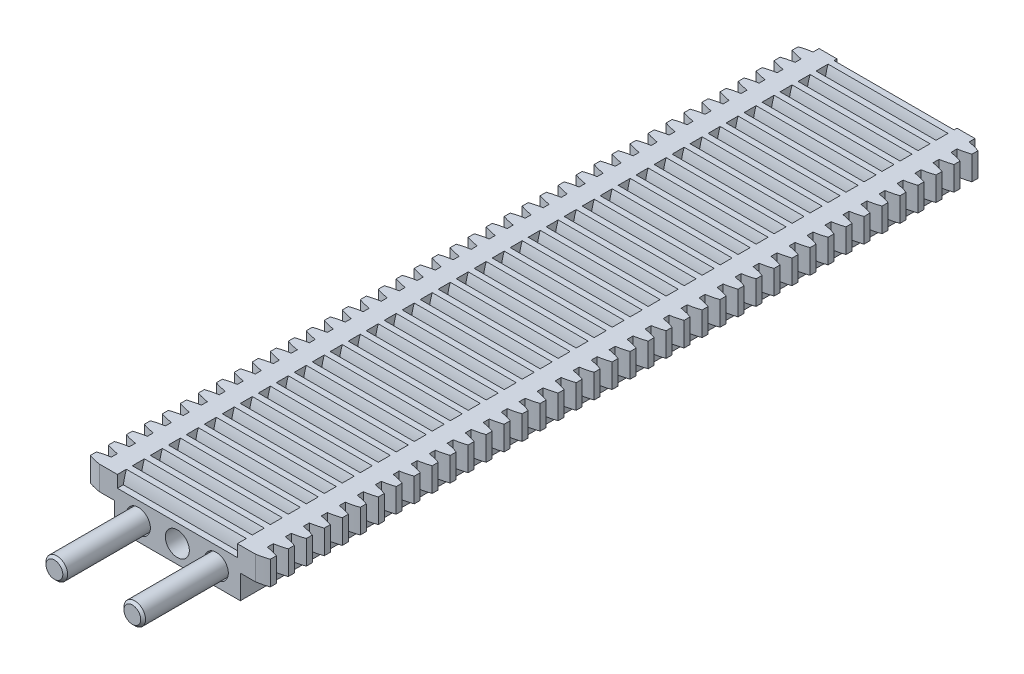
from build123d import *

# Parameters (mm, degrees)
EXTRUDE_1_DEPTH        = 60
EXTRUDE_START          = -3
EXTRUDE_2_DEPTH        = 54
SKETCH_3_R             = 1
CUT_EXTRUDE_1_DEPTH    = 61.483468816
EXTRUDE_3_DEPTH        = 7
EXTRUDE_3_DEPTH_BACK   = 7
SKETCH_4_R             = 0.9
EXTRUDE_3_2_DEPTH      = 7
EXTRUDE_3_2_DEPTH_BACK = 7
FILLET_1_R             = 0.1
CHAMFER_2_SIZE         = 0.2
CHAMFER_3_SIZE         = 0.2
EXTRUDE_4_DEPTH        = 2
CUT_EXTRUDE_2_DEPTH    = 5
CUT_EXTRUDE_START      = 5
CUT_EXTRUDE_3_DEPTH    = 5


with BuildPart() as part:
    # 草图1 → 凸台-拉伸1 (new body)
    with BuildSketch(Plane.XY):
        Polygon((5.25, 2), (6.5, 2), (6.5, 4), (-6.5, 4), (-6.5, 2), (-5.25, 2), (-5.25, 0), (5.25, 0), align=None)
    extrude(amount=-EXTRUDE_1_DEPTH)

    # 草图2 → 凸台-拉伸2 (add)
    with BuildSketch(Plane.XY.offset(EXTRUDE_START)):
        with BuildLine():
            Line((-1.95, -1.555590279), (-1.95, -2.5))
            Line((-1.95, -2.5), (-1.165769145, -2.5))
            Line((-1.165769145, -2.5), (0, 0))
            Line((0, 0), (-1.5, 0))
            Line((-1.5, 0), (-1.5, -0.677124344))
            ThreePointArc((-1.5, -0.677124344), (-1.780042303, -1.088161527), (-1.95, -1.555590279))
        make_face()
        with BuildLine():
            Line((1.5, 0), (0, 0))
            Line((0, 0), (1.165769145, -2.5))
            Line((1.165769145, -2.5), (1.95, -2.5))
            Line((1.95, -2.5), (1.95, -1.555590279))
            ThreePointArc((1.95, -1.555590279), (1.780042303, -1.088161527), (1.5, -0.677124344))
            Line((1.5, -0.677124344), (1.5, 0))
        make_face()
    extrude(amount=-EXTRUDE_2_DEPTH)

    # 草图3 → 切除-拉伸1 (cut, through all)
    with BuildSketch(Plane.XY):
        with Locations((-3.25, 1.5)):
            Circle(SKETCH_3_R)
        with Locations((0, 1.5)):
            Circle(SKETCH_3_R)
        with Locations((3.25, 1.5)):
            Circle(SKETCH_3_R)
    extrude(amount=-CUT_EXTRUDE_1_DEPTH, mode=Mode.SUBTRACT)

    # 圆角1
    fillet_1_edges = [part.edges().sort_by_distance(p)[0] for p in [
        (-1.557884573, -2.5, -57),
        (-1.165769145, -2.5, -30),
        (-1.95, -2.5, -30),
        (-1.557884573, -2.5, -3),
        (1.557884573, -2.5, -57),
        (1.95, -2.5, -30),
        (1.165769145, -2.5, -30),
        (1.557884573, -2.5, -3),
    ]]
    fillet(fillet_1_edges, radius=FILLET_1_R)

    # 草图6 → 凸台-拉伸4 (add)
    with BuildSketch(Plane(origin=(0, 4, 0), x_dir=(1, 0, 0), z_dir=(0, 1, 0))):
        with BuildLine():
            Line((-6.5, 59.5), (-6.5, 58.5))
            ThreePointArc((-6.5, 58.5), (-7.005883165, 58.601467338), (-7.5, 58.75))
            Line((-7.5, 58.75), (-7.5, 59.25))
            ThreePointArc((-7.5, 59.25), (-7.005883165, 59.398532662), (-6.5, 59.5))
        make_face()
        with BuildLine():
            Line((-6.5, 58), (-6.5, 57))
            ThreePointArc((-6.5, 57), (-7.005883165, 57.101467338), (-7.5, 57.25))
            Line((-7.5, 57.25), (-7.5, 57.75))
            ThreePointArc((-7.5, 57.75), (-7.005883165, 57.898532662), (-6.5, 58))
        make_face()
        with BuildLine():
            Line((-7.5, 56.25), (-7.5, 55.75))
            ThreePointArc((-7.5, 55.75), (-7.005883165, 55.601467338), (-6.5, 55.5))
            Line((-6.5, 55.5), (-6.5, 56.5))
            ThreePointArc((-6.5, 56.5), (-7.005883165, 56.398532662), (-7.5, 56.25))
        make_face()
        with BuildLine():
            Line((-7.5, 54.75), (-7.5, 54.25))
            ThreePointArc((-7.5, 54.25), (-7.005883165, 54.101467338), (-6.5, 54))
            Line((-6.5, 54), (-6.5, 55))
            ThreePointArc((-6.5, 55), (-7.005883165, 54.898532662), (-7.5, 54.75))
        make_face()
        with BuildLine():
            Line((-7.5, 53.25), (-7.5, 52.75))
            ThreePointArc((-7.5, 52.75), (-7.005883165, 52.601467338), (-6.5, 52.5))
            Line((-6.5, 52.5), (-6.5, 53.5))
            ThreePointArc((-6.5, 53.5), (-7.005883165, 53.398532662), (-7.5, 53.25))
        make_face()
        with BuildLine():
            Line((-7.5, 51.75), (-7.5, 51.25))
            ThreePointArc((-7.5, 51.25), (-7.005883165, 51.101467338), (-6.5, 51))
            Line((-6.5, 51), (-6.5, 52))
            ThreePointArc((-6.5, 52), (-7.005883165, 51.898532662), (-7.5, 51.75))
        make_face()
        with BuildLine():
            Line((-7.5, 50.25), (-7.5, 49.75))
            ThreePointArc((-7.5, 49.75), (-7.005883165, 49.601467338), (-6.5, 49.5))
            Line((-6.5, 49.5), (-6.5, 50.5))
            ThreePointArc((-6.5, 50.5), (-7.005883165, 50.398532662), (-7.5, 50.25))
        make_face()
        with BuildLine():
            Line((-7.5, 48.75), (-7.5, 48.25))
            ThreePointArc((-7.5, 48.25), (-7.005883165, 48.101467338), (-6.5, 48))
            Line((-6.5, 48), (-6.5, 49))
            ThreePointArc((-6.5, 49), (-7.005883165, 48.898532662), (-7.5, 48.75))
        make_face()
        with BuildLine():
            Line((-7.5, 47.25), (-7.5, 46.75))
            ThreePointArc((-7.5, 46.75), (-7.005883165, 46.601467338), (-6.5, 46.5))
            Line((-6.5, 46.5), (-6.5, 47.5))
            ThreePointArc((-6.5, 47.5), (-7.005883165, 47.398532662), (-7.5, 47.25))
        make_face()
        with BuildLine():
            Line((-7.5, 45.75), (-7.5, 45.25))
            ThreePointArc((-7.5, 45.25), (-7.005883165, 45.101467338), (-6.5, 45))
            Line((-6.5, 45), (-6.5, 46))
            ThreePointArc((-6.5, 46), (-7.005883165, 45.898532662), (-7.5, 45.75))
        make_face()
        with BuildLine():
            Line((-7.5, 44.25), (-7.5, 43.75))
            ThreePointArc((-7.5, 43.75), (-7.005883165, 43.601467338), (-6.5, 43.5))
            Line((-6.5, 43.5), (-6.5, 44.5))
            ThreePointArc((-6.5, 44.5), (-7.005883165, 44.398532662), (-7.5, 44.25))
        make_face()
        with BuildLine():
            Line((-7.5, 42.75), (-7.5, 42.25))
            ThreePointArc((-7.5, 42.25), (-7.005883165, 42.101467338), (-6.5, 42))
            Line((-6.5, 42), (-6.5, 43))
            ThreePointArc((-6.5, 43), (-7.005883165, 42.898532662), (-7.5, 42.75))
        make_face()
        with BuildLine():
            Line((-7.5, 41.25), (-7.5, 40.75))
            ThreePointArc((-7.5, 40.75), (-7.005883165, 40.601467338), (-6.5, 40.5))
            Line((-6.5, 40.5), (-6.5, 41.5))
            ThreePointArc((-6.5, 41.5), (-7.005883165, 41.398532662), (-7.5, 41.25))
        make_face()
        with BuildLine():
            Line((-7.5, 39.75), (-7.5, 39.25))
            ThreePointArc((-7.5, 39.25), (-7.005883165, 39.101467338), (-6.5, 39))
            Line((-6.5, 39), (-6.5, 40))
            ThreePointArc((-6.5, 40), (-7.005883165, 39.898532662), (-7.5, 39.75))
        make_face()
        with BuildLine():
            Line((-7.5, 38.25), (-7.5, 37.75))
            ThreePointArc((-7.5, 37.75), (-7.005883165, 37.601467338), (-6.5, 37.5))
            Line((-6.5, 37.5), (-6.5, 38.5))
            ThreePointArc((-6.5, 38.5), (-7.005883165, 38.398532662), (-7.5, 38.25))
        make_face()
        with BuildLine():
            Line((-7.5, 36.75), (-7.5, 36.25))
            ThreePointArc((-7.5, 36.25), (-7.005883165, 36.101467338), (-6.5, 36))
            Line((-6.5, 36), (-6.5, 37))
            ThreePointArc((-6.5, 37), (-7.005883165, 36.898532662), (-7.5, 36.75))
        make_face()
        with BuildLine():
            Line((-7.5, 35.25), (-7.5, 34.75))
            ThreePointArc((-7.5, 34.75), (-7.005883165, 34.601467338), (-6.5, 34.5))
            Line((-6.5, 34.5), (-6.5, 35.5))
            ThreePointArc((-6.5, 35.5), (-7.005883165, 35.398532662), (-7.5, 35.25))
        make_face()
        with BuildLine():
            Line((-7.5, 33.75), (-7.5, 33.25))
            ThreePointArc((-7.5, 33.25), (-7.005883165, 33.101467338), (-6.5, 33))
            Line((-6.5, 33), (-6.5, 34))
            ThreePointArc((-6.5, 34), (-7.005883165, 33.898532662), (-7.5, 33.75))
        make_face()
        with BuildLine():
            Line((-7.5, 32.25), (-7.5, 31.75))
            ThreePointArc((-7.5, 31.75), (-7.005883165, 31.601467338), (-6.5, 31.5))
            Line((-6.5, 31.5), (-6.5, 32.5))
            ThreePointArc((-6.5, 32.5), (-7.005883165, 32.398532662), (-7.5, 32.25))
        make_face()
        with BuildLine():
            Line((-7.5, 30.75), (-7.5, 30.25))
            ThreePointArc((-7.5, 30.25), (-7.005883165, 30.101467338), (-6.5, 30))
            Line((-6.5, 30), (-6.5, 31))
            ThreePointArc((-6.5, 31), (-7.005883165, 30.898532662), (-7.5, 30.75))
        make_face()
        with BuildLine():
            Line((-7.5, 29.25), (-7.5, 28.75))
            ThreePointArc((-7.5, 28.75), (-7.005883165, 28.601467338), (-6.5, 28.5))
            Line((-6.5, 28.5), (-6.5, 29.5))
            ThreePointArc((-6.5, 29.5), (-7.005883165, 29.398532662), (-7.5, 29.25))
        make_face()
        with BuildLine():
            Line((-7.5, 27.75), (-7.5, 27.25))
            ThreePointArc((-7.5, 27.25), (-7.005883165, 27.101467338), (-6.5, 27))
            Line((-6.5, 27), (-6.5, 28))
            ThreePointArc((-6.5, 28), (-7.005883165, 27.898532662), (-7.5, 27.75))
        make_face()
        with BuildLine():
            Line((-7.5, 26.25), (-7.5, 25.75))
            ThreePointArc((-7.5, 25.75), (-7.005883165, 25.601467338), (-6.5, 25.5))
            Line((-6.5, 25.5), (-6.5, 26.5))
            ThreePointArc((-6.5, 26.5), (-7.005883165, 26.398532662), (-7.5, 26.25))
        make_face()
        with BuildLine():
            Line((-7.5, 24.75), (-7.5, 24.25))
            ThreePointArc((-7.5, 24.25), (-7.005883165, 24.101467338), (-6.5, 24))
            Line((-6.5, 24), (-6.5, 25))
            ThreePointArc((-6.5, 25), (-7.005883165, 24.898532662), (-7.5, 24.75))
        make_face()
        with BuildLine():
            Line((-7.5, 23.25), (-7.5, 22.75))
            ThreePointArc((-7.5, 22.75), (-7.005883165, 22.601467338), (-6.5, 22.5))
            Line((-6.5, 22.5), (-6.5, 23.5))
            ThreePointArc((-6.5, 23.5), (-7.005883165, 23.398532662), (-7.5, 23.25))
        make_face()
        with BuildLine():
            Line((-7.5, 21.75), (-7.5, 21.25))
            ThreePointArc((-7.5, 21.25), (-7.005883165, 21.101467338), (-6.5, 21))
            Line((-6.5, 21), (-6.5, 22))
            ThreePointArc((-6.5, 22), (-7.005883165, 21.898532662), (-7.5, 21.75))
        make_face()
        with BuildLine():
            Line((-7.5, 20.25), (-7.5, 19.75))
            ThreePointArc((-7.5, 19.75), (-7.005883165, 19.601467338), (-6.5, 19.5))
            Line((-6.5, 19.5), (-6.5, 20.5))
            ThreePointArc((-6.5, 20.5), (-7.005883165, 20.398532662), (-7.5, 20.25))
        make_face()
        with BuildLine():
            Line((-7.5, 18.75), (-7.5, 18.25))
            ThreePointArc((-7.5, 18.25), (-7.005883165, 18.101467338), (-6.5, 18))
            Line((-6.5, 18), (-6.5, 19))
            ThreePointArc((-6.5, 19), (-7.005883165, 18.898532662), (-7.5, 18.75))
        make_face()
        with BuildLine():
            Line((-7.5, 17.25), (-7.5, 16.75))
            ThreePointArc((-7.5, 16.75), (-7.005883165, 16.601467338), (-6.5, 16.5))
            Line((-6.5, 16.5), (-6.5, 17.5))
            ThreePointArc((-6.5, 17.5), (-7.005883165, 17.398532662), (-7.5, 17.25))
        make_face()
        with BuildLine():
            Line((-7.5, 15.75), (-7.5, 15.25))
            ThreePointArc((-7.5, 15.25), (-7.005883165, 15.101467338), (-6.5, 15))
            Line((-6.5, 15), (-6.5, 16))
            ThreePointArc((-6.5, 16), (-7.005883165, 15.898532662), (-7.5, 15.75))
        make_face()
        with BuildLine():
            Line((-7.5, 14.25), (-7.5, 13.75))
            ThreePointArc((-7.5, 13.75), (-7.005883165, 13.601467338), (-6.5, 13.5))
            Line((-6.5, 13.5), (-6.5, 14.5))
            ThreePointArc((-6.5, 14.5), (-7.005883165, 14.398532662), (-7.5, 14.25))
        make_face()
        with BuildLine():
            Line((-7.5, 12.75), (-7.5, 12.25))
            ThreePointArc((-7.5, 12.25), (-7.005883165, 12.101467338), (-6.5, 12))
            Line((-6.5, 12), (-6.5, 13))
            ThreePointArc((-6.5, 13), (-7.005883165, 12.898532662), (-7.5, 12.75))
        make_face()
        with BuildLine():
            Line((-7.5, 11.25), (-7.5, 10.75))
            ThreePointArc((-7.5, 10.75), (-7.005883165, 10.601467338), (-6.5, 10.5))
            Line((-6.5, 10.5), (-6.5, 11.5))
            ThreePointArc((-6.5, 11.5), (-7.005883165, 11.398532662), (-7.5, 11.25))
        make_face()
        with BuildLine():
            Line((-7.5, 9.75), (-7.5, 9.25))
            ThreePointArc((-7.5, 9.25), (-7.005883165, 9.101467338), (-6.5, 9))
            Line((-6.5, 9), (-6.5, 10))
            ThreePointArc((-6.5, 10), (-7.005883165, 9.898532662), (-7.5, 9.75))
        make_face()
        with BuildLine():
            Line((-7.5, 8.25), (-7.5, 7.75))
            ThreePointArc((-7.5, 7.75), (-7.005883165, 7.601467338), (-6.5, 7.5))
            Line((-6.5, 7.5), (-6.5, 8.5))
            ThreePointArc((-6.5, 8.5), (-7.005883165, 8.398532662), (-7.5, 8.25))
        make_face()
        with BuildLine():
            Line((-7.5, 6.75), (-7.5, 6.25))
            ThreePointArc((-7.5, 6.25), (-7.005883165, 6.101467338), (-6.5, 6))
            Line((-6.5, 6), (-6.5, 7))
            ThreePointArc((-6.5, 7), (-7.005883165, 6.898532662), (-7.5, 6.75))
        make_face()
        with BuildLine():
            Line((-7.5, 5.25), (-7.5, 4.75))
            ThreePointArc((-7.5, 4.75), (-7.005883165, 4.601467338), (-6.5, 4.5))
            Line((-6.5, 4.5), (-6.5, 5.5))
            ThreePointArc((-6.5, 5.5), (-7.005883165, 5.398532662), (-7.5, 5.25))
        make_face()
        with BuildLine():
            Line((-7.5, 3.75), (-7.5, 3.25))
            ThreePointArc((-7.5, 3.25), (-7.005883165, 3.101467338), (-6.5, 3))
            Line((-6.5, 3), (-6.5, 4))
            ThreePointArc((-6.5, 4), (-7.005883165, 3.898532662), (-7.5, 3.75))
        make_face()
        with BuildLine():
            Line((-7.5, 2.25), (-7.5, 1.75))
            ThreePointArc((-7.5, 1.75), (-7.005883165, 1.601467338), (-6.5, 1.5))
            Line((-6.5, 1.5), (-6.5, 2.5))
            ThreePointArc((-6.5, 2.5), (-7.005883165, 2.398532662), (-7.5, 2.25))
        make_face()
        with BuildLine():
            Line((-6.5, 1), (-6.5, 0))
            ThreePointArc((-6.5, 0), (-7.005883165, 0.101467338), (-7.5, 0.25))
            Line((-7.5, 0.25), (-7.5, 0.75))
            ThreePointArc((-7.5, 0.75), (-7.005883165, 0.898532662), (-6.5, 1))
        make_face()
        with BuildLine():
            Line((7.5, 0.75), (7.5, 0.25))
            ThreePointArc((7.5, 0.25), (7.005883165, 0.101467338), (6.5, 0))
            Line((6.5, 0), (6.5, 1))
            ThreePointArc((6.5, 1), (7.005883165, 0.898532662), (7.5, 0.75))
        make_face()
        with BuildLine():
            Line((6.5, 2.5), (6.5, 1.5))
            ThreePointArc((6.5, 1.5), (7.005883165, 1.601467338), (7.5, 1.75))
            Line((7.5, 1.75), (7.5, 2.25))
            ThreePointArc((7.5, 2.25), (7.005883165, 2.398532662), (6.5, 2.5))
        make_face()
        with BuildLine():
            Line((6.5, 4), (6.5, 3))
            ThreePointArc((6.5, 3), (7.005883165, 3.101467338), (7.5, 3.25))
            Line((7.5, 3.25), (7.5, 3.75))
            ThreePointArc((7.5, 3.75), (7.005883165, 3.898532662), (6.5, 4))
        make_face()
        with BuildLine():
            Line((6.5, 5.5), (6.5, 4.5))
            ThreePointArc((6.5, 4.5), (7.005883165, 4.601467338), (7.5, 4.75))
            Line((7.5, 4.75), (7.5, 5.25))
            ThreePointArc((7.5, 5.25), (7.005883165, 5.398532662), (6.5, 5.5))
        make_face()
        with BuildLine():
            Line((6.5, 7), (6.5, 6))
            ThreePointArc((6.5, 6), (7.005883165, 6.101467338), (7.5, 6.25))
            Line((7.5, 6.25), (7.5, 6.75))
            ThreePointArc((7.5, 6.75), (7.005883165, 6.898532662), (6.5, 7))
        make_face()
        with BuildLine():
            Line((6.5, 8.5), (6.5, 7.5))
            ThreePointArc((6.5, 7.5), (7.005883165, 7.601467338), (7.5, 7.75))
            Line((7.5, 7.75), (7.5, 8.25))
            ThreePointArc((7.5, 8.25), (7.005883165, 8.398532662), (6.5, 8.5))
        make_face()
        with BuildLine():
            Line((6.5, 10), (6.5, 9))
            ThreePointArc((6.5, 9), (7.005883165, 9.101467338), (7.5, 9.25))
            Line((7.5, 9.25), (7.5, 9.75))
            ThreePointArc((7.5, 9.75), (7.005883165, 9.898532662), (6.5, 10))
        make_face()
        with BuildLine():
            Line((6.5, 11.5), (6.5, 10.5))
            ThreePointArc((6.5, 10.5), (7.005883165, 10.601467338), (7.5, 10.75))
            Line((7.5, 10.75), (7.5, 11.25))
            ThreePointArc((7.5, 11.25), (7.005883165, 11.398532662), (6.5, 11.5))
        make_face()
        with BuildLine():
            Line((6.5, 13), (6.5, 12))
            ThreePointArc((6.5, 12), (7.005883165, 12.101467338), (7.5, 12.25))
            Line((7.5, 12.25), (7.5, 12.75))
            ThreePointArc((7.5, 12.75), (7.005883165, 12.898532662), (6.5, 13))
        make_face()
        with BuildLine():
            Line((6.5, 14.5), (6.5, 13.5))
            ThreePointArc((6.5, 13.5), (7.005883165, 13.601467338), (7.5, 13.75))
            Line((7.5, 13.75), (7.5, 14.25))
            ThreePointArc((7.5, 14.25), (7.005883165, 14.398532662), (6.5, 14.5))
        make_face()
        with BuildLine():
            Line((6.5, 16), (6.5, 15))
            ThreePointArc((6.5, 15), (7.005883165, 15.101467338), (7.5, 15.25))
            Line((7.5, 15.25), (7.5, 15.75))
            ThreePointArc((7.5, 15.75), (7.005883165, 15.898532662), (6.5, 16))
        make_face()
        with BuildLine():
            Line((6.5, 17.5), (6.5, 16.5))
            ThreePointArc((6.5, 16.5), (7.005883165, 16.601467338), (7.5, 16.75))
            Line((7.5, 16.75), (7.5, 17.25))
            ThreePointArc((7.5, 17.25), (7.005883165, 17.398532662), (6.5, 17.5))
        make_face()
        with BuildLine():
            Line((6.5, 19), (6.5, 18))
            ThreePointArc((6.5, 18), (7.005883165, 18.101467338), (7.5, 18.25))
            Line((7.5, 18.25), (7.5, 18.75))
            ThreePointArc((7.5, 18.75), (7.005883165, 18.898532662), (6.5, 19))
        make_face()
        with BuildLine():
            Line((6.5, 20.5), (6.5, 19.5))
            ThreePointArc((6.5, 19.5), (7.005883165, 19.601467338), (7.5, 19.75))
            Line((7.5, 19.75), (7.5, 20.25))
            ThreePointArc((7.5, 20.25), (7.005883165, 20.398532662), (6.5, 20.5))
        make_face()
        with BuildLine():
            Line((6.5, 22), (6.5, 21))
            ThreePointArc((6.5, 21), (7.005883165, 21.101467338), (7.5, 21.25))
            Line((7.5, 21.25), (7.5, 21.75))
            ThreePointArc((7.5, 21.75), (7.005883165, 21.898532662), (6.5, 22))
        make_face()
        with BuildLine():
            Line((6.5, 23.5), (6.5, 22.5))
            ThreePointArc((6.5, 22.5), (7.005883165, 22.601467338), (7.5, 22.75))
            Line((7.5, 22.75), (7.5, 23.25))
            ThreePointArc((7.5, 23.25), (7.005883165, 23.398532662), (6.5, 23.5))
        make_face()
        with BuildLine():
            Line((6.5, 25), (6.5, 24))
            ThreePointArc((6.5, 24), (7.005883165, 24.101467338), (7.5, 24.25))
            Line((7.5, 24.25), (7.5, 24.75))
            ThreePointArc((7.5, 24.75), (7.005883165, 24.898532662), (6.5, 25))
        make_face()
        with BuildLine():
            Line((6.5, 26.5), (6.5, 25.5))
            ThreePointArc((6.5, 25.5), (7.005883165, 25.601467338), (7.5, 25.75))
            Line((7.5, 25.75), (7.5, 26.25))
            ThreePointArc((7.5, 26.25), (7.005883165, 26.398532662), (6.5, 26.5))
        make_face()
        with BuildLine():
            Line((6.5, 28), (6.5, 27))
            ThreePointArc((6.5, 27), (7.005883165, 27.101467338), (7.5, 27.25))
            Line((7.5, 27.25), (7.5, 27.75))
            ThreePointArc((7.5, 27.75), (7.005883165, 27.898532662), (6.5, 28))
        make_face()
        with BuildLine():
            Line((6.5, 29.5), (6.5, 28.5))
            ThreePointArc((6.5, 28.5), (7.005883165, 28.601467338), (7.5, 28.75))
            Line((7.5, 28.75), (7.5, 29.25))
            ThreePointArc((7.5, 29.25), (7.005883165, 29.398532662), (6.5, 29.5))
        make_face()
        with BuildLine():
            Line((6.5, 31), (6.5, 30))
            ThreePointArc((6.5, 30), (7.005883165, 30.101467338), (7.5, 30.25))
            Line((7.5, 30.25), (7.5, 30.75))
            ThreePointArc((7.5, 30.75), (7.005883165, 30.898532662), (6.5, 31))
        make_face()
        with BuildLine():
            Line((6.5, 32.5), (6.5, 31.5))
            ThreePointArc((6.5, 31.5), (7.005883165, 31.601467338), (7.5, 31.75))
            Line((7.5, 31.75), (7.5, 32.25))
            ThreePointArc((7.5, 32.25), (7.005883165, 32.398532662), (6.5, 32.5))
        make_face()
        with BuildLine():
            Line((6.5, 34), (6.5, 33))
            ThreePointArc((6.5, 33), (7.005883165, 33.101467338), (7.5, 33.25))
            Line((7.5, 33.25), (7.5, 33.75))
            ThreePointArc((7.5, 33.75), (7.005883165, 33.898532662), (6.5, 34))
        make_face()
        with BuildLine():
            Line((6.5, 35.5), (6.5, 34.5))
            ThreePointArc((6.5, 34.5), (7.005883165, 34.601467338), (7.5, 34.75))
            Line((7.5, 34.75), (7.5, 35.25))
            ThreePointArc((7.5, 35.25), (7.005883165, 35.398532662), (6.5, 35.5))
        make_face()
        with BuildLine():
            Line((6.5, 37), (6.5, 36))
            ThreePointArc((6.5, 36), (7.005883165, 36.101467338), (7.5, 36.25))
            Line((7.5, 36.25), (7.5, 36.75))
            ThreePointArc((7.5, 36.75), (7.005883165, 36.898532662), (6.5, 37))
        make_face()
        with BuildLine():
            Line((6.5, 38.5), (6.5, 37.5))
            ThreePointArc((6.5, 37.5), (7.005883165, 37.601467338), (7.5, 37.75))
            Line((7.5, 37.75), (7.5, 38.25))
            ThreePointArc((7.5, 38.25), (7.005883165, 38.398532662), (6.5, 38.5))
        make_face()
        with BuildLine():
            Line((6.5, 40), (6.5, 39))
            ThreePointArc((6.5, 39), (7.005883165, 39.101467338), (7.5, 39.25))
            Line((7.5, 39.25), (7.5, 39.75))
            ThreePointArc((7.5, 39.75), (7.005883165, 39.898532662), (6.5, 40))
        make_face()
        with BuildLine():
            Line((6.5, 41.5), (6.5, 40.5))
            ThreePointArc((6.5, 40.5), (7.005883165, 40.601467338), (7.5, 40.75))
            Line((7.5, 40.75), (7.5, 41.25))
            ThreePointArc((7.5, 41.25), (7.005883165, 41.398532662), (6.5, 41.5))
        make_face()
        with BuildLine():
            Line((6.5, 43), (6.5, 42))
            ThreePointArc((6.5, 42), (7.005883165, 42.101467338), (7.5, 42.25))
            Line((7.5, 42.25), (7.5, 42.75))
            ThreePointArc((7.5, 42.75), (7.005883165, 42.898532662), (6.5, 43))
        make_face()
        with BuildLine():
            Line((6.5, 44.5), (6.5, 43.5))
            ThreePointArc((6.5, 43.5), (7.005883165, 43.601467338), (7.5, 43.75))
            Line((7.5, 43.75), (7.5, 44.25))
            ThreePointArc((7.5, 44.25), (7.005883165, 44.398532662), (6.5, 44.5))
        make_face()
        with BuildLine():
            Line((6.5, 46), (6.5, 45))
            ThreePointArc((6.5, 45), (7.005883165, 45.101467338), (7.5, 45.25))
            Line((7.5, 45.25), (7.5, 45.75))
            ThreePointArc((7.5, 45.75), (7.005883165, 45.898532662), (6.5, 46))
        make_face()
        with BuildLine():
            Line((6.5, 47.5), (6.5, 46.5))
            ThreePointArc((6.5, 46.5), (7.005883165, 46.601467338), (7.5, 46.75))
            Line((7.5, 46.75), (7.5, 47.25))
            ThreePointArc((7.5, 47.25), (7.005883165, 47.398532662), (6.5, 47.5))
        make_face()
        with BuildLine():
            Line((6.5, 49), (6.5, 48))
            ThreePointArc((6.5, 48), (7.005883165, 48.101467338), (7.5, 48.25))
            Line((7.5, 48.25), (7.5, 48.75))
            ThreePointArc((7.5, 48.75), (7.005883165, 48.898532662), (6.5, 49))
        make_face()
        with BuildLine():
            Line((6.5, 50.5), (6.5, 49.5))
            ThreePointArc((6.5, 49.5), (7.005883165, 49.601467338), (7.5, 49.75))
            Line((7.5, 49.75), (7.5, 50.25))
            ThreePointArc((7.5, 50.25), (7.005883165, 50.398532662), (6.5, 50.5))
        make_face()
        with BuildLine():
            Line((6.5, 52), (6.5, 51))
            ThreePointArc((6.5, 51), (7.005883165, 51.101467338), (7.5, 51.25))
            Line((7.5, 51.25), (7.5, 51.75))
            ThreePointArc((7.5, 51.75), (7.005883165, 51.898532662), (6.5, 52))
        make_face()
        with BuildLine():
            Line((6.5, 53.5), (6.5, 52.5))
            ThreePointArc((6.5, 52.5), (7.005883165, 52.601467338), (7.5, 52.75))
            Line((7.5, 52.75), (7.5, 53.25))
            ThreePointArc((7.5, 53.25), (7.005883165, 53.398532662), (6.5, 53.5))
        make_face()
        with BuildLine():
            Line((6.5, 55), (6.5, 54))
            ThreePointArc((6.5, 54), (7.005883165, 54.101467338), (7.5, 54.25))
            Line((7.5, 54.25), (7.5, 54.75))
            ThreePointArc((7.5, 54.75), (7.005883165, 54.898532662), (6.5, 55))
        make_face()
        with BuildLine():
            Line((6.5, 56.5), (6.5, 55.5))
            ThreePointArc((6.5, 55.5), (7.005883165, 55.601467338), (7.5, 55.75))
            Line((7.5, 55.75), (7.5, 56.25))
            ThreePointArc((7.5, 56.25), (7.005883165, 56.398532662), (6.5, 56.5))
        make_face()
        with BuildLine():
            Line((7.5, 57.75), (7.5, 57.25))
            ThreePointArc((7.5, 57.25), (7.005883165, 57.101467338), (6.5, 57))
            Line((6.5, 57), (6.5, 58))
            ThreePointArc((6.5, 58), (7.005883165, 57.898532662), (7.5, 57.75))
        make_face()
        with BuildLine():
            Line((7.5, 59.25), (7.5, 58.75))
            ThreePointArc((7.5, 58.75), (7.005883165, 58.601467338), (6.5, 58.5))
            Line((6.5, 58.5), (6.5, 59.5))
            ThreePointArc((6.5, 59.5), (7.005883165, 59.398532662), (7.5, 59.25))
        make_face()
    extrude(amount=-EXTRUDE_4_DEPTH)

    # 草图7 → 切除-拉伸2 (cut)
    with BuildSketch(Plane(origin=(0, 0, 0), x_dir=(0, 0, -1), z_dir=(1, 0, 0))):
        with BuildLine():
            Line((2.75, 4), (3.75, 4))
            ThreePointArc((3.75, 4), (3.601467338, 3.505883165), (3.5, 3))
            Line((3.5, 3), (3, 3))
            ThreePointArc((3, 3), (2.898532662, 3.505883165), (2.75, 4))
        make_face()
        with BuildLine():
            Line((4.25, 4), (5.25, 4))
            ThreePointArc((5.25, 4), (5.101467338, 3.505883165), (5, 3))
            Line((5, 3), (4.5, 3))
            ThreePointArc((4.5, 3), (4.398532662, 3.505883165), (4.25, 4))
        make_face()
        with BuildLine():
            Line((1.5, 3), (2, 3))
            ThreePointArc((2, 3), (2.101467338, 3.505883165), (2.25, 4))
            Line((2.25, 4), (1.25, 4))
            ThreePointArc((1.25, 4), (1.398532662, 3.505883165), (1.5, 3))
        make_face()
        with BuildLine():
            Line((0.5, 3), (0, 3))
            ThreePointArc((0, 3), (-0.101467338, 3.505883165), (-0.25, 4))
            Line((-0.25, 4), (0.75, 4))
            ThreePointArc((0.75, 4), (0.601467338, 3.505883165), (0.5, 3))
        make_face()
        with BuildLine():
            Line((5.75, 4), (6.75, 4))
            ThreePointArc((6.75, 4), (6.601467338, 3.505883165), (6.5, 3))
            Line((6.5, 3), (6, 3))
            ThreePointArc((6, 3), (5.898532662, 3.505883165), (5.75, 4))
        make_face()
        with BuildLine():
            Line((9, 3), (9.5, 3))
            ThreePointArc((9.5, 3), (9.601467338, 3.505883165), (9.75, 4))
            Line((9.75, 4), (8.75, 4))
            ThreePointArc((8.75, 4), (8.898532662, 3.505883165), (9, 3))
        make_face()
        with BuildLine():
            Line((11.75, 4), (12.75, 4))
            ThreePointArc((12.75, 4), (12.601467338, 3.505883165), (12.5, 3))
            Line((12.5, 3), (12, 3))
            ThreePointArc((12, 3), (11.898532662, 3.505883165), (11.75, 4))
        make_face()
        with BuildLine():
            Line((10.25, 4), (11.25, 4))
            ThreePointArc((11.25, 4), (11.101467338, 3.505883165), (11, 3))
            Line((11, 3), (10.5, 3))
            ThreePointArc((10.5, 3), (10.398532662, 3.505883165), (10.25, 4))
        make_face()
        with BuildLine():
            Line((7.25, 4), (8.25, 4))
            ThreePointArc((8.25, 4), (8.101467338, 3.505883165), (8, 3))
            Line((8, 3), (7.5, 3))
            ThreePointArc((7.5, 3), (7.398532662, 3.505883165), (7.25, 4))
        make_face()
        with BuildLine():
            Line((15, 3), (15.5, 3))
            ThreePointArc((15.5, 3), (15.601467338, 3.505883165), (15.75, 4))
            Line((15.75, 4), (14.75, 4))
            ThreePointArc((14.75, 4), (14.898532662, 3.505883165), (15, 3))
        make_face()
        with BuildLine():
            Line((17.75, 4), (18.75, 4))
            ThreePointArc((18.75, 4), (18.601467338, 3.505883165), (18.5, 3))
            Line((18.5, 3), (18, 3))
            ThreePointArc((18, 3), (17.898532662, 3.505883165), (17.75, 4))
        make_face()
        with BuildLine():
            Line((16.25, 4), (17.25, 4))
            ThreePointArc((17.25, 4), (17.101467338, 3.505883165), (17, 3))
            Line((17, 3), (16.5, 3))
            ThreePointArc((16.5, 3), (16.398532662, 3.505883165), (16.25, 4))
        make_face()
        with BuildLine():
            Line((13.25, 4), (14.25, 4))
            ThreePointArc((14.25, 4), (14.101467338, 3.505883165), (14, 3))
            Line((14, 3), (13.5, 3))
            ThreePointArc((13.5, 3), (13.398532662, 3.505883165), (13.25, 4))
        make_face()
        with BuildLine():
            Line((24, 3), (24.5, 3))
            ThreePointArc((24.5, 3), (24.601467338, 3.505883165), (24.75, 4))
            Line((24.75, 4), (23.75, 4))
            ThreePointArc((23.75, 4), (23.898532662, 3.505883165), (24, 3))
        make_face()
        with BuildLine():
            Line((20.75, 4), (21.75, 4))
            ThreePointArc((21.75, 4), (21.601467338, 3.505883165), (21.5, 3))
            Line((21.5, 3), (21, 3))
            ThreePointArc((21, 3), (20.898532662, 3.505883165), (20.75, 4))
        make_face()
        with BuildLine():
            Line((19.5, 3), (20, 3))
            ThreePointArc((20, 3), (20.101467338, 3.505883165), (20.25, 4))
            Line((20.25, 4), (19.25, 4))
            ThreePointArc((19.25, 4), (19.398532662, 3.505883165), (19.5, 3))
        make_face()
        with BuildLine():
            Line((22.25, 4), (23.25, 4))
            ThreePointArc((23.25, 4), (23.101467338, 3.505883165), (23, 3))
            Line((23, 3), (22.5, 3))
            ThreePointArc((22.5, 3), (22.398532662, 3.505883165), (22.25, 4))
        make_face()
        with BuildLine():
            Line((30, 3), (30.5, 3))
            ThreePointArc((30.5, 3), (30.601467338, 3.505883165), (30.75, 4))
            Line((30.75, 4), (29.75, 4))
            ThreePointArc((29.75, 4), (29.898532662, 3.505883165), (30, 3))
        make_face()
        with BuildLine():
            Line((26.75, 4), (27.75, 4))
            ThreePointArc((27.75, 4), (27.601467338, 3.505883165), (27.5, 3))
            Line((27.5, 3), (27, 3))
            ThreePointArc((27, 3), (26.898532662, 3.505883165), (26.75, 4))
        make_face()
        with BuildLine():
            Line((25.5, 3), (26, 3))
            ThreePointArc((26, 3), (26.101467338, 3.505883165), (26.25, 4))
            Line((26.25, 4), (25.25, 4))
            ThreePointArc((25.25, 4), (25.398532662, 3.505883165), (25.5, 3))
        make_face()
        with BuildLine():
            Line((28.25, 4), (29.25, 4))
            ThreePointArc((29.25, 4), (29.101467338, 3.505883165), (29, 3))
            Line((29, 3), (28.5, 3))
            ThreePointArc((28.5, 3), (28.398532662, 3.505883165), (28.25, 4))
        make_face()
        with BuildLine():
            Line((36, 3), (36.5, 3))
            ThreePointArc((36.5, 3), (36.601467338, 3.505883165), (36.75, 4))
            Line((36.75, 4), (35.75, 4))
            ThreePointArc((35.75, 4), (35.898532662, 3.505883165), (36, 3))
        make_face()
        with BuildLine():
            Line((32.75, 4), (33.75, 4))
            ThreePointArc((33.75, 4), (33.601467338, 3.505883165), (33.5, 3))
            Line((33.5, 3), (33, 3))
            ThreePointArc((33, 3), (32.898532662, 3.505883165), (32.75, 4))
        make_face()
        with BuildLine():
            Line((31.5, 3), (32, 3))
            ThreePointArc((32, 3), (32.101467338, 3.505883165), (32.25, 4))
            Line((32.25, 4), (31.25, 4))
            ThreePointArc((31.25, 4), (31.398532662, 3.505883165), (31.5, 3))
        make_face()
        with BuildLine():
            Line((34.25, 4), (35.25, 4))
            ThreePointArc((35.25, 4), (35.101467338, 3.505883165), (35, 3))
            Line((35, 3), (34.5, 3))
            ThreePointArc((34.5, 3), (34.398532662, 3.505883165), (34.25, 4))
        make_face()
        with BuildLine():
            Line((42, 3), (42.5, 3))
            ThreePointArc((42.5, 3), (42.601467338, 3.505883165), (42.75, 4))
            Line((42.75, 4), (41.75, 4))
            ThreePointArc((41.75, 4), (41.898532662, 3.505883165), (42, 3))
        make_face()
        with BuildLine():
            Line((38.75, 4), (39.75, 4))
            ThreePointArc((39.75, 4), (39.601467338, 3.505883165), (39.5, 3))
            Line((39.5, 3), (39, 3))
            ThreePointArc((39, 3), (38.898532662, 3.505883165), (38.75, 4))
        make_face()
        with BuildLine():
            Line((37.5, 3), (38, 3))
            ThreePointArc((38, 3), (38.101467338, 3.505883165), (38.25, 4))
            Line((38.25, 4), (37.25, 4))
            ThreePointArc((37.25, 4), (37.398532662, 3.505883165), (37.5, 3))
        make_face()
        with BuildLine():
            Line((40.25, 4), (41.25, 4))
            ThreePointArc((41.25, 4), (41.101467338, 3.505883165), (41, 3))
            Line((41, 3), (40.5, 3))
            ThreePointArc((40.5, 3), (40.398532662, 3.505883165), (40.25, 4))
        make_face()
        with BuildLine():
            Line((48, 3), (48.5, 3))
            ThreePointArc((48.5, 3), (48.601467338, 3.505883165), (48.75, 4))
            Line((48.75, 4), (47.75, 4))
            ThreePointArc((47.75, 4), (47.898532662, 3.505883165), (48, 3))
        make_face()
        with BuildLine():
            Line((44.75, 4), (45.75, 4))
            ThreePointArc((45.75, 4), (45.601467338, 3.505883165), (45.5, 3))
            Line((45.5, 3), (45, 3))
            ThreePointArc((45, 3), (44.898532662, 3.505883165), (44.75, 4))
        make_face()
        with BuildLine():
            Line((43.5, 3), (44, 3))
            ThreePointArc((44, 3), (44.101467338, 3.505883165), (44.25, 4))
            Line((44.25, 4), (43.25, 4))
            ThreePointArc((43.25, 4), (43.398532662, 3.505883165), (43.5, 3))
        make_face()
        with BuildLine():
            Line((46.25, 4), (47.25, 4))
            ThreePointArc((47.25, 4), (47.101467338, 3.505883165), (47, 3))
            Line((47, 3), (46.5, 3))
            ThreePointArc((46.5, 3), (46.398532662, 3.505883165), (46.25, 4))
        make_face()
        with BuildLine():
            Line((54, 3), (54.5, 3))
            ThreePointArc((54.5, 3), (54.601467338, 3.505883165), (54.75, 4))
            Line((54.75, 4), (53.75, 4))
            ThreePointArc((53.75, 4), (53.898532662, 3.505883165), (54, 3))
        make_face()
        with BuildLine():
            Line((50.75, 4), (51.75, 4))
            ThreePointArc((51.75, 4), (51.601467338, 3.505883165), (51.5, 3))
            Line((51.5, 3), (51, 3))
            ThreePointArc((51, 3), (50.898532662, 3.505883165), (50.75, 4))
        make_face()
        with BuildLine():
            Line((49.5, 3), (50, 3))
            ThreePointArc((50, 3), (50.101467338, 3.505883165), (50.25, 4))
            Line((50.25, 4), (49.25, 4))
            ThreePointArc((49.25, 4), (49.398532662, 3.505883165), (49.5, 3))
        make_face()
        with BuildLine():
            Line((52.25, 4), (53.25, 4))
            ThreePointArc((53.25, 4), (53.101467338, 3.505883165), (53, 3))
            Line((53, 3), (52.5, 3))
            ThreePointArc((52.5, 3), (52.398532662, 3.505883165), (52.25, 4))
        make_face()
        with BuildLine():
            Line((56.75, 4), (57.75, 4))
            ThreePointArc((57.75, 4), (57.601467338, 3.505883165), (57.5, 3))
            Line((57.5, 3), (57, 3))
            ThreePointArc((57, 3), (56.898532662, 3.505883165), (56.75, 4))
        make_face()
        with BuildLine():
            Line((55.5, 3), (56, 3))
            ThreePointArc((56, 3), (56.101467338, 3.505883165), (56.25, 4))
            Line((56.25, 4), (55.25, 4))
            ThreePointArc((55.25, 4), (55.398532662, 3.505883165), (55.5, 3))
        make_face()
        with BuildLine():
            Line((58.25, 4), (59.25, 4))
            ThreePointArc((59.25, 4), (59.101467338, 3.505883165), (59, 3))
            Line((59, 3), (58.5, 3))
            ThreePointArc((58.5, 3), (58.398532662, 3.505883165), (58.25, 4))
        make_face()
        with BuildLine():
            Line((60.5, 3), (60, 3))
            ThreePointArc((60, 3), (59.898532662, 3.505883165), (59.75, 4))
            Line((59.75, 4), (60.75, 4))
            ThreePointArc((60.75, 4), (60.601467338, 3.505883165), (60.5, 3))
        make_face()
    extrude(amount=-CUT_EXTRUDE_2_DEPTH, mode=Mode.SUBTRACT)

    # 草图7<2> → 切除-拉伸3 (cut)
    with BuildSketch(Plane(origin=(0, 0, 0), x_dir=(0, 0, -1), z_dir=(1, 0, 0)).offset(CUT_EXTRUDE_START)):
        with BuildLine():
            Line((2.75, 4), (3.75, 4))
            ThreePointArc((3.75, 4), (3.601467338, 3.505883165), (3.5, 3))
            Line((3.5, 3), (3, 3))
            ThreePointArc((3, 3), (2.898532662, 3.505883165), (2.75, 4))
        make_face()
        with BuildLine():
            Line((4.25, 4), (5.25, 4))
            ThreePointArc((5.25, 4), (5.101467338, 3.505883165), (5, 3))
            Line((5, 3), (4.5, 3))
            ThreePointArc((4.5, 3), (4.398532662, 3.505883165), (4.25, 4))
        make_face()
        with BuildLine():
            Line((1.5, 3), (2, 3))
            ThreePointArc((2, 3), (2.101467338, 3.505883165), (2.25, 4))
            Line((2.25, 4), (1.25, 4))
            ThreePointArc((1.25, 4), (1.398532662, 3.505883165), (1.5, 3))
        make_face()
        with BuildLine():
            Line((0.5, 3), (0, 3))
            ThreePointArc((0, 3), (-0.101467338, 3.505883165), (-0.25, 4))
            Line((-0.25, 4), (0.75, 4))
            ThreePointArc((0.75, 4), (0.601467338, 3.505883165), (0.5, 3))
        make_face()
        with BuildLine():
            Line((5.75, 4), (6.75, 4))
            ThreePointArc((6.75, 4), (6.601467338, 3.505883165), (6.5, 3))
            Line((6.5, 3), (6, 3))
            ThreePointArc((6, 3), (5.898532662, 3.505883165), (5.75, 4))
        make_face()
        with BuildLine():
            Line((9, 3), (9.5, 3))
            ThreePointArc((9.5, 3), (9.601467338, 3.505883165), (9.75, 4))
            Line((9.75, 4), (8.75, 4))
            ThreePointArc((8.75, 4), (8.898532662, 3.505883165), (9, 3))
        make_face()
        with BuildLine():
            Line((11.75, 4), (12.75, 4))
            ThreePointArc((12.75, 4), (12.601467338, 3.505883165), (12.5, 3))
            Line((12.5, 3), (12, 3))
            ThreePointArc((12, 3), (11.898532662, 3.505883165), (11.75, 4))
        make_face()
        with BuildLine():
            Line((10.25, 4), (11.25, 4))
            ThreePointArc((11.25, 4), (11.101467338, 3.505883165), (11, 3))
            Line((11, 3), (10.5, 3))
            ThreePointArc((10.5, 3), (10.398532662, 3.505883165), (10.25, 4))
        make_face()
        with BuildLine():
            Line((7.25, 4), (8.25, 4))
            ThreePointArc((8.25, 4), (8.101467338, 3.505883165), (8, 3))
            Line((8, 3), (7.5, 3))
            ThreePointArc((7.5, 3), (7.398532662, 3.505883165), (7.25, 4))
        make_face()
        with BuildLine():
            Line((15, 3), (15.5, 3))
            ThreePointArc((15.5, 3), (15.601467338, 3.505883165), (15.75, 4))
            Line((15.75, 4), (14.75, 4))
            ThreePointArc((14.75, 4), (14.898532662, 3.505883165), (15, 3))
        make_face()
        with BuildLine():
            Line((17.75, 4), (18.75, 4))
            ThreePointArc((18.75, 4), (18.601467338, 3.505883165), (18.5, 3))
            Line((18.5, 3), (18, 3))
            ThreePointArc((18, 3), (17.898532662, 3.505883165), (17.75, 4))
        make_face()
        with BuildLine():
            Line((16.25, 4), (17.25, 4))
            ThreePointArc((17.25, 4), (17.101467338, 3.505883165), (17, 3))
            Line((17, 3), (16.5, 3))
            ThreePointArc((16.5, 3), (16.398532662, 3.505883165), (16.25, 4))
        make_face()
        with BuildLine():
            Line((13.25, 4), (14.25, 4))
            ThreePointArc((14.25, 4), (14.101467338, 3.505883165), (14, 3))
            Line((14, 3), (13.5, 3))
            ThreePointArc((13.5, 3), (13.398532662, 3.505883165), (13.25, 4))
        make_face()
        with BuildLine():
            Line((24, 3), (24.5, 3))
            ThreePointArc((24.5, 3), (24.601467338, 3.505883165), (24.75, 4))
            Line((24.75, 4), (23.75, 4))
            ThreePointArc((23.75, 4), (23.898532662, 3.505883165), (24, 3))
        make_face()
        with BuildLine():
            Line((20.75, 4), (21.75, 4))
            ThreePointArc((21.75, 4), (21.601467338, 3.505883165), (21.5, 3))
            Line((21.5, 3), (21, 3))
            ThreePointArc((21, 3), (20.898532662, 3.505883165), (20.75, 4))
        make_face()
        with BuildLine():
            Line((19.5, 3), (20, 3))
            ThreePointArc((20, 3), (20.101467338, 3.505883165), (20.25, 4))
            Line((20.25, 4), (19.25, 4))
            ThreePointArc((19.25, 4), (19.398532662, 3.505883165), (19.5, 3))
        make_face()
        with BuildLine():
            Line((22.25, 4), (23.25, 4))
            ThreePointArc((23.25, 4), (23.101467338, 3.505883165), (23, 3))
            Line((23, 3), (22.5, 3))
            ThreePointArc((22.5, 3), (22.398532662, 3.505883165), (22.25, 4))
        make_face()
        with BuildLine():
            Line((30, 3), (30.5, 3))
            ThreePointArc((30.5, 3), (30.601467338, 3.505883165), (30.75, 4))
            Line((30.75, 4), (29.75, 4))
            ThreePointArc((29.75, 4), (29.898532662, 3.505883165), (30, 3))
        make_face()
        with BuildLine():
            Line((26.75, 4), (27.75, 4))
            ThreePointArc((27.75, 4), (27.601467338, 3.505883165), (27.5, 3))
            Line((27.5, 3), (27, 3))
            ThreePointArc((27, 3), (26.898532662, 3.505883165), (26.75, 4))
        make_face()
        with BuildLine():
            Line((25.5, 3), (26, 3))
            ThreePointArc((26, 3), (26.101467338, 3.505883165), (26.25, 4))
            Line((26.25, 4), (25.25, 4))
            ThreePointArc((25.25, 4), (25.398532662, 3.505883165), (25.5, 3))
        make_face()
        with BuildLine():
            Line((28.25, 4), (29.25, 4))
            ThreePointArc((29.25, 4), (29.101467338, 3.505883165), (29, 3))
            Line((29, 3), (28.5, 3))
            ThreePointArc((28.5, 3), (28.398532662, 3.505883165), (28.25, 4))
        make_face()
        with BuildLine():
            Line((36, 3), (36.5, 3))
            ThreePointArc((36.5, 3), (36.601467338, 3.505883165), (36.75, 4))
            Line((36.75, 4), (35.75, 4))
            ThreePointArc((35.75, 4), (35.898532662, 3.505883165), (36, 3))
        make_face()
        with BuildLine():
            Line((32.75, 4), (33.75, 4))
            ThreePointArc((33.75, 4), (33.601467338, 3.505883165), (33.5, 3))
            Line((33.5, 3), (33, 3))
            ThreePointArc((33, 3), (32.898532662, 3.505883165), (32.75, 4))
        make_face()
        with BuildLine():
            Line((31.5, 3), (32, 3))
            ThreePointArc((32, 3), (32.101467338, 3.505883165), (32.25, 4))
            Line((32.25, 4), (31.25, 4))
            ThreePointArc((31.25, 4), (31.398532662, 3.505883165), (31.5, 3))
        make_face()
        with BuildLine():
            Line((34.25, 4), (35.25, 4))
            ThreePointArc((35.25, 4), (35.101467338, 3.505883165), (35, 3))
            Line((35, 3), (34.5, 3))
            ThreePointArc((34.5, 3), (34.398532662, 3.505883165), (34.25, 4))
        make_face()
        with BuildLine():
            Line((42, 3), (42.5, 3))
            ThreePointArc((42.5, 3), (42.601467338, 3.505883165), (42.75, 4))
            Line((42.75, 4), (41.75, 4))
            ThreePointArc((41.75, 4), (41.898532662, 3.505883165), (42, 3))
        make_face()
        with BuildLine():
            Line((38.75, 4), (39.75, 4))
            ThreePointArc((39.75, 4), (39.601467338, 3.505883165), (39.5, 3))
            Line((39.5, 3), (39, 3))
            ThreePointArc((39, 3), (38.898532662, 3.505883165), (38.75, 4))
        make_face()
        with BuildLine():
            Line((37.5, 3), (38, 3))
            ThreePointArc((38, 3), (38.101467338, 3.505883165), (38.25, 4))
            Line((38.25, 4), (37.25, 4))
            ThreePointArc((37.25, 4), (37.398532662, 3.505883165), (37.5, 3))
        make_face()
        with BuildLine():
            Line((40.25, 4), (41.25, 4))
            ThreePointArc((41.25, 4), (41.101467338, 3.505883165), (41, 3))
            Line((41, 3), (40.5, 3))
            ThreePointArc((40.5, 3), (40.398532662, 3.505883165), (40.25, 4))
        make_face()
        with BuildLine():
            Line((48, 3), (48.5, 3))
            ThreePointArc((48.5, 3), (48.601467338, 3.505883165), (48.75, 4))
            Line((48.75, 4), (47.75, 4))
            ThreePointArc((47.75, 4), (47.898532662, 3.505883165), (48, 3))
        make_face()
        with BuildLine():
            Line((44.75, 4), (45.75, 4))
            ThreePointArc((45.75, 4), (45.601467338, 3.505883165), (45.5, 3))
            Line((45.5, 3), (45, 3))
            ThreePointArc((45, 3), (44.898532662, 3.505883165), (44.75, 4))
        make_face()
        with BuildLine():
            Line((43.5, 3), (44, 3))
            ThreePointArc((44, 3), (44.101467338, 3.505883165), (44.25, 4))
            Line((44.25, 4), (43.25, 4))
            ThreePointArc((43.25, 4), (43.398532662, 3.505883165), (43.5, 3))
        make_face()
        with BuildLine():
            Line((46.25, 4), (47.25, 4))
            ThreePointArc((47.25, 4), (47.101467338, 3.505883165), (47, 3))
            Line((47, 3), (46.5, 3))
            ThreePointArc((46.5, 3), (46.398532662, 3.505883165), (46.25, 4))
        make_face()
        with BuildLine():
            Line((54, 3), (54.5, 3))
            ThreePointArc((54.5, 3), (54.601467338, 3.505883165), (54.75, 4))
            Line((54.75, 4), (53.75, 4))
            ThreePointArc((53.75, 4), (53.898532662, 3.505883165), (54, 3))
        make_face()
        with BuildLine():
            Line((50.75, 4), (51.75, 4))
            ThreePointArc((51.75, 4), (51.601467338, 3.505883165), (51.5, 3))
            Line((51.5, 3), (51, 3))
            ThreePointArc((51, 3), (50.898532662, 3.505883165), (50.75, 4))
        make_face()
        with BuildLine():
            Line((49.5, 3), (50, 3))
            ThreePointArc((50, 3), (50.101467338, 3.505883165), (50.25, 4))
            Line((50.25, 4), (49.25, 4))
            ThreePointArc((49.25, 4), (49.398532662, 3.505883165), (49.5, 3))
        make_face()
        with BuildLine():
            Line((52.25, 4), (53.25, 4))
            ThreePointArc((53.25, 4), (53.101467338, 3.505883165), (53, 3))
            Line((53, 3), (52.5, 3))
            ThreePointArc((52.5, 3), (52.398532662, 3.505883165), (52.25, 4))
        make_face()
        with BuildLine():
            Line((56.75, 4), (57.75, 4))
            ThreePointArc((57.75, 4), (57.601467338, 3.505883165), (57.5, 3))
            Line((57.5, 3), (57, 3))
            ThreePointArc((57, 3), (56.898532662, 3.505883165), (56.75, 4))
        make_face()
        with BuildLine():
            Line((55.5, 3), (56, 3))
            ThreePointArc((56, 3), (56.101467338, 3.505883165), (56.25, 4))
            Line((56.25, 4), (55.25, 4))
            ThreePointArc((55.25, 4), (55.398532662, 3.505883165), (55.5, 3))
        make_face()
        with BuildLine():
            Line((58.25, 4), (59.25, 4))
            ThreePointArc((59.25, 4), (59.101467338, 3.505883165), (59, 3))
            Line((59, 3), (58.5, 3))
            ThreePointArc((58.5, 3), (58.398532662, 3.505883165), (58.25, 4))
        make_face()
        with BuildLine():
            Line((60.5, 3), (60, 3))
            ThreePointArc((60, 3), (59.898532662, 3.505883165), (59.75, 4))
            Line((59.75, 4), (60.75, 4))
            ThreePointArc((60.75, 4), (60.601467338, 3.505883165), (60.5, 3))
        make_face()
    extrude(amount=-CUT_EXTRUDE_3_DEPTH, mode=Mode.SUBTRACT)


with BuildPart() as body_2:
    # 草图4 → 凸台-拉伸3 (new, two sides: drawn at the far end of the back side and taken through both)
    with BuildSketch(Plane.XY.offset(-EXTRUDE_3_DEPTH_BACK)):
        with Locations((-3.25, 1.5)):
            Circle(SKETCH_4_R)
    extrude(amount=EXTRUDE_3_DEPTH + EXTRUDE_3_DEPTH_BACK)

    # 倒角2
    chamfer_2_edges = [body_2.edges().sort_by_distance(p)[0] for p in [
        (-4.15, 1.5, 7),
    ]]
    chamfer(chamfer_2_edges, length=CHAMFER_2_SIZE)


with BuildPart() as body_3:
    # 草图4 → Extrude 3 2 (new, two sides: drawn at the far end of the back side and taken through both)
    with BuildSketch(Plane.XY.offset(-EXTRUDE_3_2_DEPTH_BACK)):
        with Locations((3.25, 1.5)):
            Circle(SKETCH_4_R)
    extrude(amount=EXTRUDE_3_2_DEPTH + EXTRUDE_3_2_DEPTH_BACK)

    # 倒角3
    chamfer_3_edges = [body_3.edges().sort_by_distance(p)[0] for p in [
        (2.35, 1.5, 7),
    ]]
    chamfer(chamfer_3_edges, length=CHAMFER_3_SIZE)


solid = Compound([part.part, body_2.part, body_3.part])
